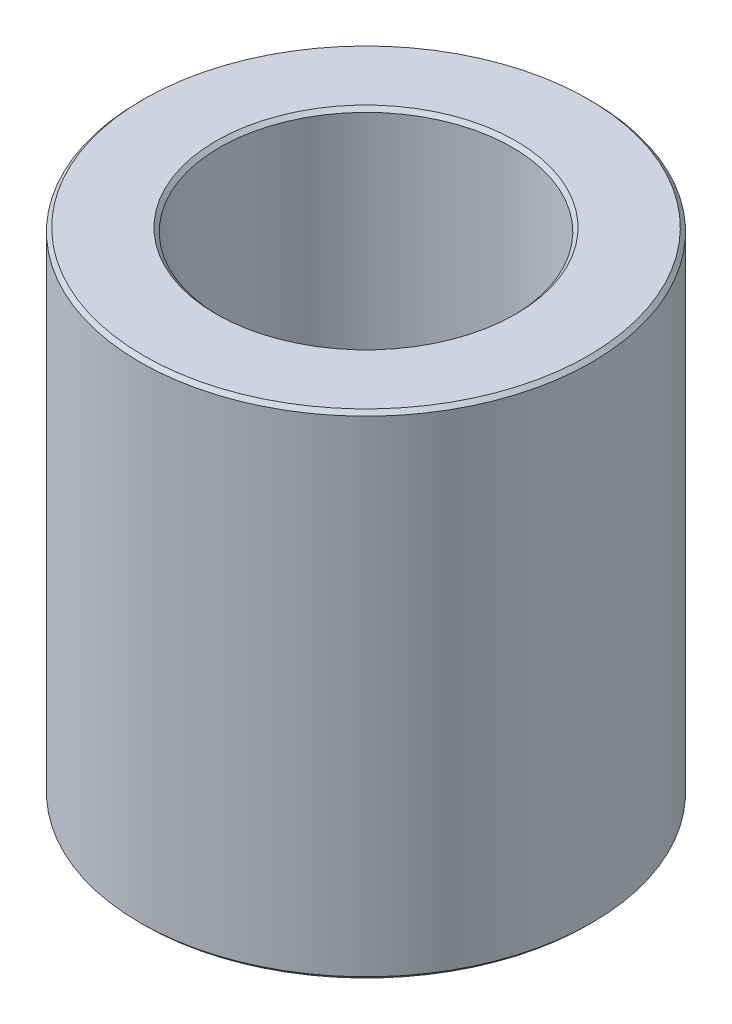
from build123d import *

# Parameters (mm, degrees)
SKETCH1_R           = 27.5
BOSS_EXTRUDE1_DEPTH = 59.98598768
SKETCH2_R           = 17.799156063
CUT_EXTRUDE1_DEPTH  = 72.489990334
CHAMFER1_SIZE       = 0.450641966


with BuildPart() as part:
    # Sketch1 → Boss-Extrude1 (new body)
    with BuildSketch(Plane(origin=(0, 0, 0), x_dir=(1, 0, 0), z_dir=(0, 1, 0))):
        Circle(SKETCH1_R)
    extrude(amount=BOSS_EXTRUDE1_DEPTH)

    # Sketch2 → Cut-Extrude1 (cut, through all)
    with BuildSketch(Plane(origin=(0, 0, 0), x_dir=(1, 0, 0), z_dir=(0, 1, 0))):
        Circle(SKETCH2_R)
    extrude(amount=CUT_EXTRUDE1_DEPTH, mode=Mode.SUBTRACT)

    # Chamfer1
    chamfer1_edges = [part.edges().sort_by_distance(p)[0] for p in [
        (-17.799156063, 59.98598768, 0),
        (-17.799156063, 0, 0),
        (-27.5, 0, 0),
        (-27.5, 59.98598768, 0),
    ]]
    chamfer(chamfer1_edges, length=CHAMFER1_SIZE)


solid = part.part
